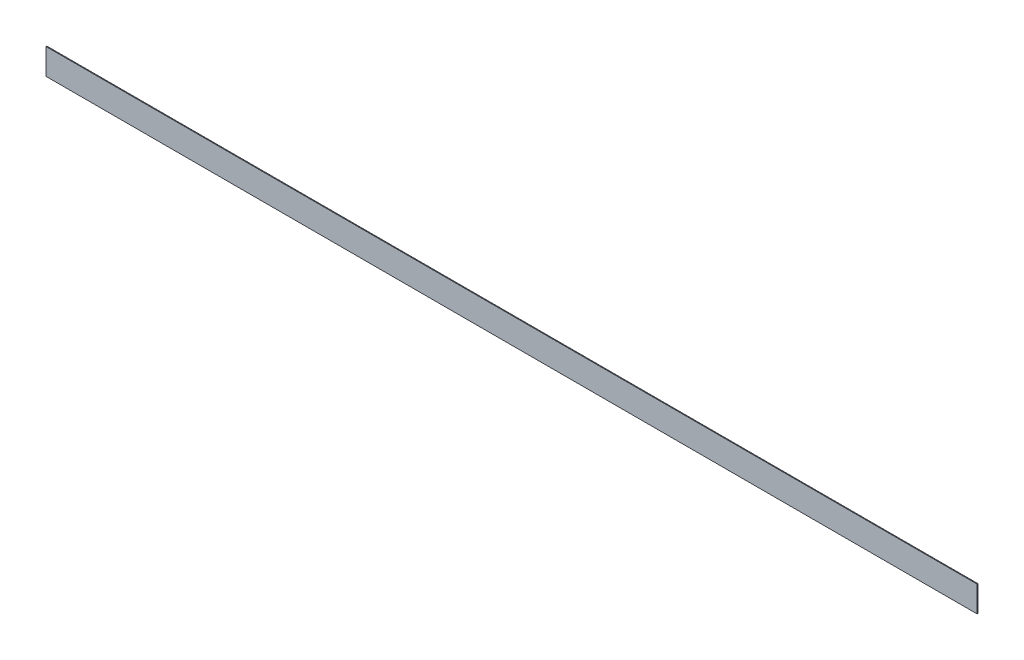
from build123d import *

# Parameters (mm, degrees)
SKETCH1_W           = 1828.8
SKETCH1_H           = 50.8
BOSS_EXTRUDE1_DEPTH = 1.5875


with BuildPart() as part:
    # Sketch1 → Boss-Extrude1 (new body)
    with BuildSketch(Plane.XY):
        with Locations((914.4, 25.4)):
            Rectangle(SKETCH1_W, SKETCH1_H)
    extrude(amount=BOSS_EXTRUDE1_DEPTH)


solid = part.part
